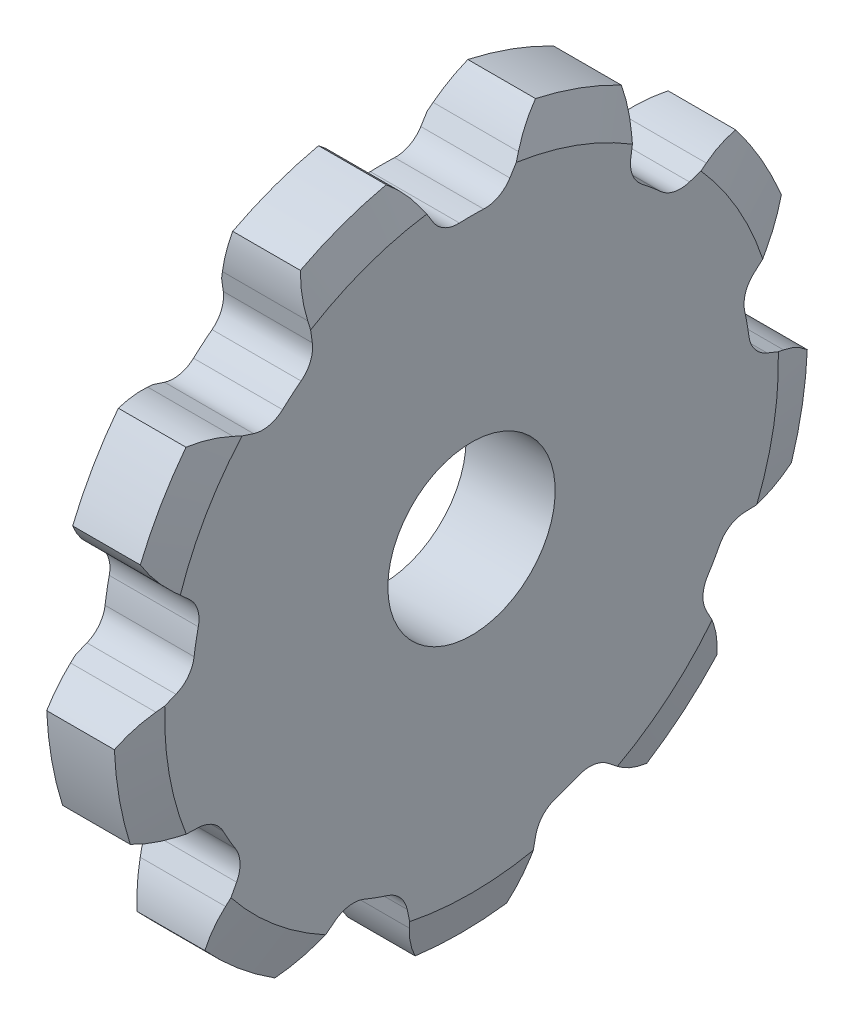
from build123d import *

# Parameters (mm, degrees)
TOOTHCUT_DEPTH  = 152.293123699
TEETHCUTS_COUNT = 9
TEETHCUTS_ANGLE = 320
BORSKE_R        = 25.4
BORE_DEPTH      = 76.2000508


with BuildPart() as part:
    # BasProSke → Base-Revolve (revolve)
    with BuildSketch(Plane(origin=(0, 0, 0), x_dir=(1, 0, 0), z_dir=(0, 1, 0))):
        Polygon((0, 0), (0, 93.156431696), (3.243072, 105.259741172), (23.782528, 105.259741172), (27.0256, 93.156431696), (27.0256, 0), align=None)
    revolve(axis=Axis((-10, 0, 0), (1, 0, 0)))

    # TooCutSke → ToothCut (cut, through all)
    with BuildSketch(Plane(origin=(0, 0, 0), x_dir=(0, 0, -1), z_dir=(1, 0, 0))):
        with BuildLine():
            Line((-11.639118127, 89.055413732), (-14.799648825, 94.113320138))
            ThreePointArc((-14.799648825, 94.113320138), (-25.527429219, 104.770164711), (-39.873178027, 109.550656272))
            Line((-39.873178027, 109.550656272), (-44.216833848, 121.484752556))
            ThreePointArc((-44.216833848, 121.484752556), (0, 129.281373365), (44.216833848, 121.484752556))
            Line((44.216833848, 121.484752556), (39.873178027, 109.550656272))
            ThreePointArc((39.873178027, 109.550656272), (25.527429219, 104.770164711), (14.799648825, 94.113320138))
            Line((14.799648825, 94.113320138), (11.639118127, 89.055413732))
            ThreePointArc((11.639118127, 89.055413732), (8.221464811, 85.88166506), (3.670530011, 84.860867691))
            ThreePointArc((3.670530011, 84.860867691), (0, 84.940212242), (-3.670530011, 84.860867691))
            ThreePointArc((-3.670530011, 84.860867691), (-8.221464811, 85.88166506), (-11.639118127, 89.055413732))
        make_face()
    toothcut = extrude(amount=TOOTHCUT_DEPTH, mode=Mode.SUBTRACT)

    # TeethCuts: ToothCut ×9 about axis
    teethcuts_axis = Axis((-10, 0, 0), (1, 0, 0))
    for i in range(1, TEETHCUTS_COUNT):
        add(toothcut.rotate(teethcuts_axis, i * TEETHCUTS_ANGLE / (TEETHCUTS_COUNT - 1)), mode=Mode.SUBTRACT)

    # BorSke → Bore (cut, symmetric)
    with BuildSketch(Plane(origin=(0, 0, 0), x_dir=(0, 0, -1), z_dir=(1, 0, 0))):
        Circle(BORSKE_R)
    extrude(amount=BORE_DEPTH, both=True, mode=Mode.SUBTRACT)


solid = part.part
